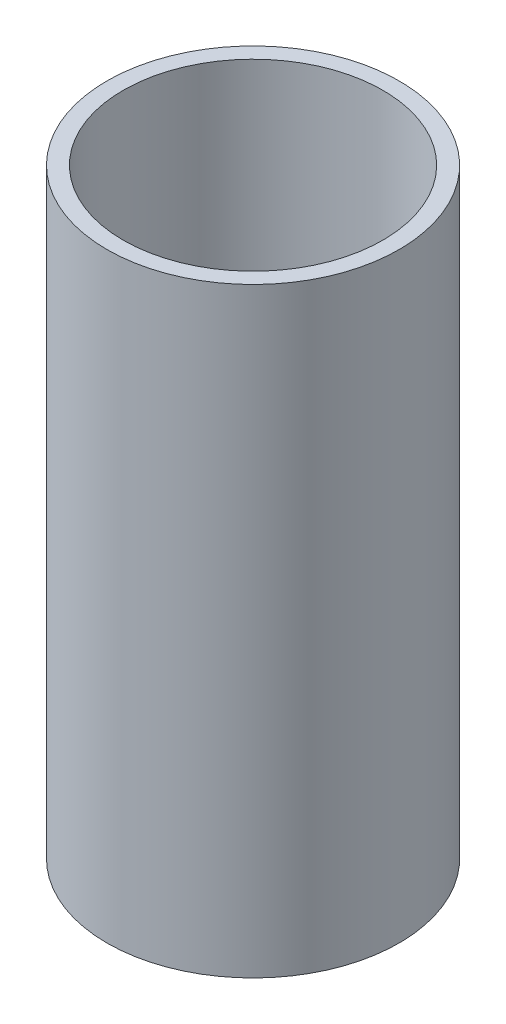
from build123d import *

# Parameters (mm, degrees)
SKETCH1_R           = 11.43
SKETCH1_R_2         = 10.16
BOSS_EXTRUDE1_DEPTH = 46.99


with BuildPart() as part:
    # Sketch1 → Boss-Extrude1 (new body)
    with BuildSketch(Plane(origin=(0, 0, 0), x_dir=(1, 0, 0), z_dir=(0, 1, 0))):
        Circle(SKETCH1_R)
        Circle(SKETCH1_R_2, mode=Mode.SUBTRACT)
    extrude(amount=BOSS_EXTRUDE1_DEPTH)


solid = part.part
